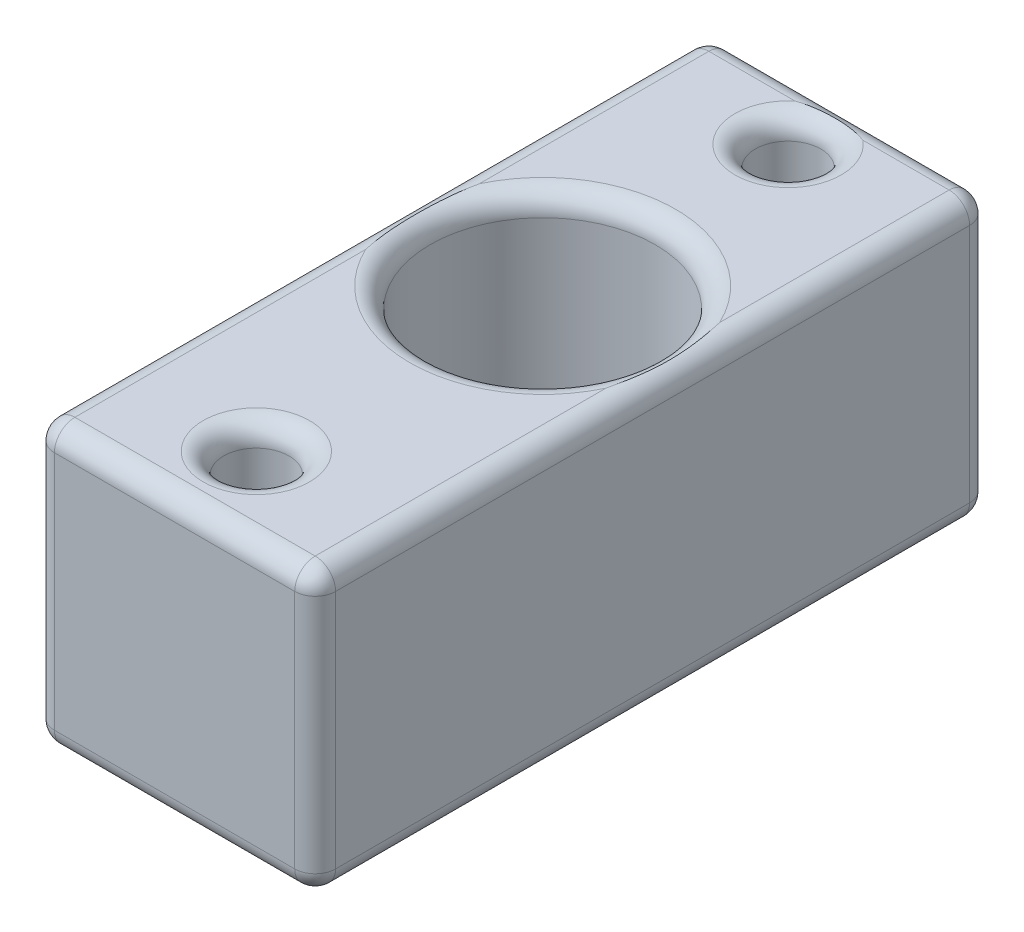
from build123d import *

# Parameters (mm, degrees)
BOSS_EXTRUDE1_DEPTH      = 18
BOSS_EXTRUDE1_DEPTH_BACK = 15
SKETCH1_W                = 13.75
SKETCH1_H                = 13.75
CUT_EXTRUDE1_DEPTH       = 10
CUT_EXTRUDE1_DEPTH_BACK  = 10
SKETCH2_R                = 1.6
SKETCH2_R_2              = 5.5
FILLET1_R                = 1


with BuildPart() as part:
    # Sketch1 → Boss-Extrude1 (new, two sides: drawn at the far end of the back side and taken through both)
    with BuildSketch(Plane.XY.offset(-BOSS_EXTRUDE1_DEPTH_BACK)):
        Rectangle(SKETCH1_W, SKETCH1_H)
    extrude(amount=BOSS_EXTRUDE1_DEPTH + BOSS_EXTRUDE1_DEPTH_BACK)

    # Sketch2 → Cut-Extrude1 (cut, two sides: drawn at the far end of the back side and taken through both)
    with BuildSketch(Plane(origin=(0, 0, 0), x_dir=(1, 0, 0), z_dir=(0, 1, 0)).offset(-CUT_EXTRUDE1_DEPTH_BACK)):
        with Locations(Location((0, 12, 0), (0, 0, 90))):
            Circle(SKETCH2_R)
        with Locations(Location((0, -14, 0), (0, 0, 90))):
            Circle(SKETCH2_R)
        with Locations(Location((0, 0, 0), (0, 0, 90))):
            Circle(SKETCH2_R_2)
    extrude(amount=CUT_EXTRUDE1_DEPTH + CUT_EXTRUDE1_DEPTH_BACK, mode=Mode.SUBTRACT)

    # Fillet1
    # the kernel refuses this fillet: 1 mm, written as the material it takes off along each edge
    with BuildSketch(Plane(origin=(5.875, -5.875, 17), x_dir=(1, 0, 0), z_dir=(0, -1, 0))) as fillet1_piece_1_section:
        Polygon((0, 0), (FILLET1_R, 0), (FILLET1_R, FILLET1_R), (0, FILLET1_R), align=None)
    fillet1_piece_1 = extrude(amount=FILLET1_R, mode=Mode.PRIVATE)
    fillet1_piece_1 = fillet1_piece_1 - Plane(origin=(5.875, -5.875, 17), x_dir=(-0.7071067811865475, 0, -0.7071067811865475), z_dir=(0, -1, 0)) * Sphere(FILLET1_R, mode=Mode.PRIVATE)
    add(fillet1_piece_1, mode=Mode.SUBTRACT)
    with BuildSketch(Plane(origin=(5.875, 5.875, 17), x_dir=(1, 0, 0), z_dir=(0, 1, 0))) as fillet1_piece_2_section:
        Polygon((0, 0), (FILLET1_R, 0), (FILLET1_R, -FILLET1_R), (0, -FILLET1_R), align=None)
    fillet1_piece_2 = extrude(amount=FILLET1_R, mode=Mode.PRIVATE)
    fillet1_piece_2 = fillet1_piece_2 - Plane(origin=(5.875, 5.875, 17), x_dir=(-0.7071067811865475, 0, -0.7071067811865475), z_dir=(0, 1, 0)) * Sphere(FILLET1_R, mode=Mode.PRIVATE)
    add(fillet1_piece_2, mode=Mode.SUBTRACT)
    with BuildSketch(Plane(origin=(-5.875, 5.875, -14), x_dir=(0, 1, 0), z_dir=(-1, 0, 0))) as fillet1_piece_3_section:
        Polygon((0, 0), (FILLET1_R, 0), (FILLET1_R, FILLET1_R), (0, FILLET1_R), align=None)
    fillet1_piece_3 = extrude(amount=FILLET1_R, mode=Mode.PRIVATE)
    fillet1_piece_3 = fillet1_piece_3 - Plane(origin=(-5.875, 5.875, -14), x_dir=(0, -0.7071067811865475, 0.7071067811865475), z_dir=(-1, 0, 0)) * Sphere(FILLET1_R, mode=Mode.PRIVATE)
    add(fillet1_piece_3, mode=Mode.SUBTRACT)
    with BuildSketch(Plane(origin=(-5.875, -5.875, -14), x_dir=(0, -1, 0), z_dir=(-1, 0, 0))) as fillet1_piece_4_section:
        Polygon((0, 0), (FILLET1_R, 0), (FILLET1_R, -FILLET1_R), (0, -FILLET1_R), align=None)
    fillet1_piece_4 = extrude(amount=FILLET1_R, mode=Mode.PRIVATE)
    fillet1_piece_4 = fillet1_piece_4 - Plane(origin=(-5.875, -5.875, -14), x_dir=(0, 0.7071067811865475, 0.7071067811865475), z_dir=(-1, 0, 0)) * Sphere(FILLET1_R, mode=Mode.PRIVATE)
    add(fillet1_piece_4, mode=Mode.SUBTRACT)
    with BuildSketch(Plane(origin=(-5.875, 5.875, 17), x_dir=(0, 1, 0), z_dir=(-1, 0, 0))) as fillet1_piece_5_section:
        Polygon((0, 0), (FILLET1_R, 0), (FILLET1_R, -FILLET1_R), (0, -FILLET1_R), align=None)
    fillet1_piece_5 = extrude(amount=FILLET1_R, mode=Mode.PRIVATE)
    fillet1_piece_5 = fillet1_piece_5 - Plane(origin=(-5.875, 5.875, 17), x_dir=(0, -0.7071067811865475, -0.7071067811865475), z_dir=(-1, 0, 0)) * Sphere(FILLET1_R, mode=Mode.PRIVATE)
    add(fillet1_piece_5, mode=Mode.SUBTRACT)
    with BuildSketch(Plane(origin=(-5.875, -5.875, 17), x_dir=(0, -1, 0), z_dir=(-1, 0, 0))) as fillet1_piece_6_section:
        Polygon((0, 0), (FILLET1_R, 0), (FILLET1_R, FILLET1_R), (0, FILLET1_R), align=None)
    fillet1_piece_6 = extrude(amount=FILLET1_R, mode=Mode.PRIVATE)
    fillet1_piece_6 = fillet1_piece_6 - Plane(origin=(-5.875, -5.875, 17), x_dir=(0, 0.7071067811865475, -0.7071067811865475), z_dir=(-1, 0, 0)) * Sphere(FILLET1_R, mode=Mode.PRIVATE)
    add(fillet1_piece_6, mode=Mode.SUBTRACT)
    with BuildSketch(Plane(origin=(5.875, -5.875, -14), x_dir=(1, 0, 0), z_dir=(0, -1, 0))) as fillet1_piece_7_section:
        Polygon((0, 0), (FILLET1_R, 0), (FILLET1_R, -FILLET1_R), (0, -FILLET1_R), align=None)
    fillet1_piece_7 = extrude(amount=FILLET1_R, mode=Mode.PRIVATE)
    fillet1_piece_7 = fillet1_piece_7 - Plane(origin=(5.875, -5.875, -14), x_dir=(-0.7071067811865475, 0, 0.7071067811865475), z_dir=(0, -1, 0)) * Sphere(FILLET1_R, mode=Mode.PRIVATE)
    add(fillet1_piece_7, mode=Mode.SUBTRACT)
    with BuildSketch(Plane(origin=(5.875, 5.875, -14), x_dir=(1, 0, 0), z_dir=(0, 1, 0))) as fillet1_piece_8_section:
        Polygon((0, 0), (FILLET1_R, 0), (FILLET1_R, FILLET1_R), (0, FILLET1_R), align=None)
    fillet1_piece_8 = extrude(amount=FILLET1_R, mode=Mode.PRIVATE)
    fillet1_piece_8 = fillet1_piece_8 - Plane(origin=(5.875, 5.875, -14), x_dir=(-0.7071067811865475, 0, 0.7071067811865475), z_dir=(0, 1, 0)) * Sphere(FILLET1_R, mode=Mode.PRIVATE)
    add(fillet1_piece_8, mode=Mode.SUBTRACT)
    with BuildSketch(Plane(origin=(6.875, -5.875, 18), x_dir=(0, 0, -1), z_dir=(0, 1, 0)), Plane(origin=(-6.875, 5.875, -15), x_dir=(1, 0, 0), z_dir=(0, -1, 0)), Plane(origin=(5.875, 6.875, 18), x_dir=(0, 0, -1), z_dir=(-1, 0, 0)), Plane(origin=(-5.875, -6.875, 18), x_dir=(0, 0, -1), z_dir=(1, 0, 0))) as fillet1_piece_9:
        with BuildLine():
            CenterArc((FILLET1_R, FILLET1_R), FILLET1_R, 180, 90)
            Line((0, FILLET1_R), (0, 0))
            Line((0, 0), (FILLET1_R, 0))
        make_face()
    extrude(amount=11.75, mode=Mode.SUBTRACT)
    with BuildSketch(Plane(origin=(-6.875, 5.875, 18), x_dir=(1, 0, 0), z_dir=(0, -1, 0)), Plane(origin=(-5.875, -6.875, -15), x_dir=(0, 0, 1), z_dir=(1, 0, 0)), Plane(origin=(6.875, -5.875, -15), x_dir=(0, 0, 1), z_dir=(0, 1, 0)), Plane(origin=(5.875, 6.875, -15), x_dir=(0, 0, 1), z_dir=(-1, 0, 0))) as fillet1_piece_10:
        with BuildLine():
            CenterArc((FILLET1_R, -FILLET1_R), FILLET1_R, 90, 90)
            Line((0, -FILLET1_R), (0, 0))
            Line((0, 0), (FILLET1_R, 0))
        make_face()
    extrude(amount=11.75, mode=Mode.SUBTRACT)
    with BuildSketch(Plane(origin=(0, -6.875, 14), x_dir=(0, 0, -1), z_dir=(1, 0, 0))) as fillet1_piece_11:
        with BuildLine():
            CenterArc((1.6 + FILLET1_R, FILLET1_R), FILLET1_R, 180, 90)
            Line((1.6, FILLET1_R), (1.6, 0))
            Line((1.6, 0), (1.6 + FILLET1_R, 0))
        make_face()
    revolve(axis=Axis((0, -6.875, 14), (0, 1, 0)), mode=Mode.SUBTRACT)
    with BuildSketch(Plane(origin=(0, 6.875, 14), x_dir=(0, 0, -1), z_dir=(-1, 0, 0))) as fillet1_piece_12:
        with BuildLine():
            CenterArc((1.6 + FILLET1_R, FILLET1_R), FILLET1_R, 180, 90)
            Line((1.6, FILLET1_R), (1.6, 0))
            Line((1.6, 0), (1.6 + FILLET1_R, 0))
        make_face()
    revolve(axis=Axis((0, 6.875, 14), (0, -1, 0)), mode=Mode.SUBTRACT)
    with BuildSketch(Plane(origin=(0, -6.875, 0), x_dir=(0, 0, -1), z_dir=(1, 0, 0))) as fillet1_piece_13:
        with BuildLine():
            CenterArc((5.5 + FILLET1_R, FILLET1_R), FILLET1_R, 180, 90)
            Line((5.5, FILLET1_R), (5.5, 0))
            Line((5.5, 0), (5.5 + FILLET1_R, 0))
        make_face()
    revolve(axis=Axis((0, -6.875, 0), (0, 1, 0)), mode=Mode.SUBTRACT)
    with BuildSketch(Plane(origin=(0, 6.875, 0), x_dir=(0, 0, -1), z_dir=(-1, 0, 0))) as fillet1_piece_14:
        with BuildLine():
            CenterArc((5.5 + FILLET1_R, FILLET1_R), FILLET1_R, 180, 90)
            Line((5.5, FILLET1_R), (5.5, 0))
            Line((5.5, 0), (5.5 + FILLET1_R, 0))
        make_face()
    revolve(axis=Axis((0, 6.875, 0), (0, -1, 0)), mode=Mode.SUBTRACT)
    with BuildSketch(Plane(origin=(0, -6.875, -12), x_dir=(0, 0, -1), z_dir=(1, 0, 0))) as fillet1_piece_15:
        with BuildLine():
            CenterArc((1.6 + FILLET1_R, FILLET1_R), FILLET1_R, 180, 90)
            Line((1.6, FILLET1_R), (1.6, 0))
            Line((1.6, 0), (1.6 + FILLET1_R, 0))
        make_face()
    revolve(axis=Axis((0, -6.875, -12), (0, 1, 0)), mode=Mode.SUBTRACT)
    with BuildSketch(Plane(origin=(0, 6.875, -12), x_dir=(0, 0, -1), z_dir=(-1, 0, 0))) as fillet1_piece_16:
        with BuildLine():
            CenterArc((1.6 + FILLET1_R, FILLET1_R), FILLET1_R, 180, 90)
            Line((1.6 + FILLET1_R, 0), (1.6, 0))
            Line((1.6, 0), (1.6, FILLET1_R))
        make_face()
    revolve(axis=Axis((0, 6.875, -12), (0, -1, 0)), mode=Mode.SUBTRACT)
    with BuildSketch(Plane(origin=(6.875, -6.875, -14), x_dir=(-1, 0, 0), z_dir=(0, 0, 1)), Plane(origin=(-6.875, -6.875, 17), x_dir=(1, 0, 0), z_dir=(0, 0, -1))) as fillet1_piece_17:
        with BuildLine():
            CenterArc((FILLET1_R, -FILLET1_R), FILLET1_R, 90, 90)
            Line((0, -FILLET1_R), (0, 0))
            Line((0, 0), (FILLET1_R, 0))
        make_face()
    extrude(amount=31, mode=Mode.SUBTRACT)
    with BuildSketch(Plane(origin=(-6.875, 6.875, 17), x_dir=(1, 0, 0), z_dir=(0, 0, -1)), Plane(origin=(6.875, 6.875, -14), x_dir=(-1, 0, 0), z_dir=(0, 0, 1))) as fillet1_piece_18:
        with BuildLine():
            CenterArc((FILLET1_R, FILLET1_R), FILLET1_R, 180, 90)
            Line((0, FILLET1_R), (0, 0))
            Line((0, 0), (FILLET1_R, 0))
        make_face()
    extrude(amount=31, mode=Mode.SUBTRACT)


solid = part.part
